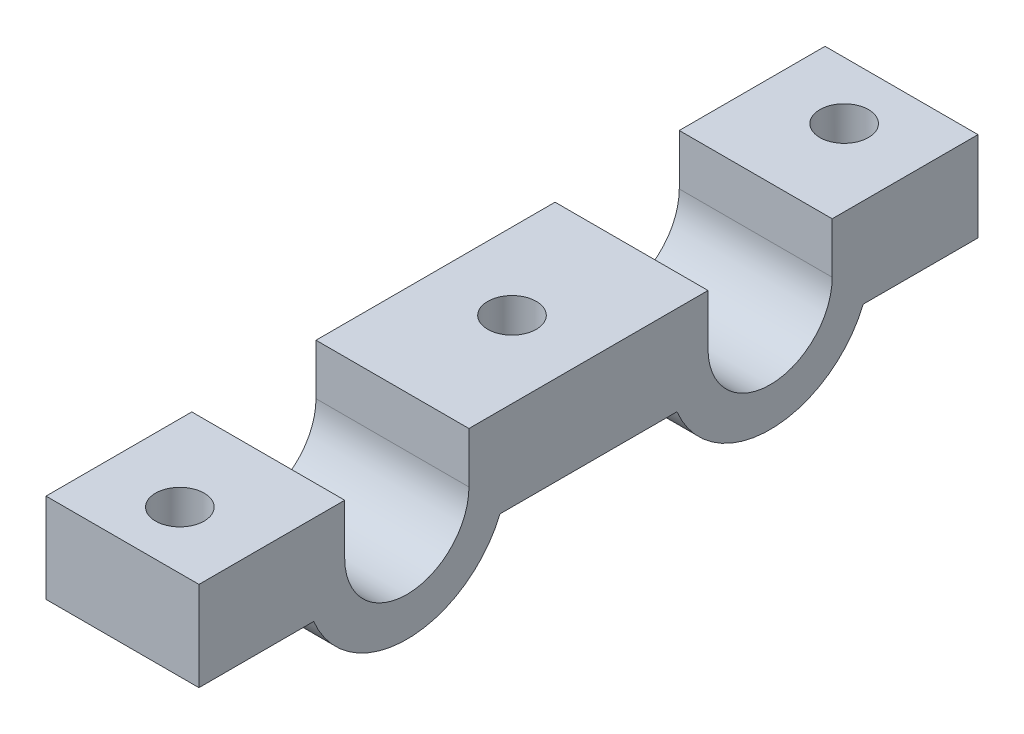
from build123d import *

# Parameters (mm, degrees)
BOSS_EXTRUDE1_DEPTH = 40
CUT_EXTRUDE1_REACH  = 161.63
SKETCH3_R           = 6.35


with BuildPart() as part:
    # Sketch2 → Boss-Extrude1 (new body)
    with BuildSketch(Plane(origin=(0, 0, 0), x_dir=(0, 0, -1), z_dir=(1, 0, 0))):
        with BuildLine():
            Line((-24.366665755, -10.16), (-54.366665755, -10.16))
            Line((-54.366665755, -10.16), (-54.366665755, 0))
            Line((-54.366665755, 0), (-54.366665755, 13.24))
            Line((-54.366665755, 13.24), (-16.24, 13.24))
            Line((-16.24, 13.24), (-16.24, 0))
            ThreePointArc((-16.24, 0), (0, -16.24), (16.24, 0))
            Line((16.24, 0), (16.24, 13.24))
            Line((16.24, 13.24), (78.76, 13.24))
            Line((78.76, 13.24), (78.76, 0))
            ThreePointArc((78.76, 0), (95, -16.24), (111.24, 0))
            Line((111.24, 0), (111.24, 13.24))
            Line((111.24, 13.24), (149.366665755, 13.24))
            Line((149.366665755, 13.24), (149.366665755, 0))
            Line((149.366665755, 0), (149.366665755, -10.16))
            Line((149.366665755, -10.16), (119.366665755, -10.16))
            ThreePointArc((119.366665755, -10.16), (95, -26.4), (70.633334245, -10.16))
            Line((70.633334245, -10.16), (24.366665755, -10.16))
            ThreePointArc((24.366665755, -10.16), (0, -26.4), (-24.366665755, -10.16))
        make_face()
    extrude(amount=BOSS_EXTRUDE1_DEPTH)

    # Sketch3 → Cut-Extrude1 (cut, up to next)
    with BuildSketch(Plane(origin=(0, 13.24, 0), x_dir=(1, 0, 0), z_dir=(0, 1, 0)), mode=Mode.PRIVATE) as cut_extrude1_sk1:
        with Locations((20, -39.366665755)):
            Circle(SKETCH3_R)
    cut_extrude1_tool1 = extrude(cut_extrude1_sk1.sketch, amount=-CUT_EXTRUDE1_REACH, mode=Mode.PRIVATE) & part.part
    # Sketch3 → Cut-Extrude1 (cut, up to next)
    with BuildSketch(Plane(origin=(0, 13.24, 0), x_dir=(1, 0, 0), z_dir=(0, 1, 0)), mode=Mode.PRIVATE) as cut_extrude1_sk2:
        with Locations((20, 134.366665755)):
            Circle(SKETCH3_R)
    cut_extrude1_tool2 = extrude(cut_extrude1_sk2.sketch, amount=-CUT_EXTRUDE1_REACH, mode=Mode.PRIVATE) & part.part
    # Sketch3 → Cut-Extrude1 (cut, up to next)
    with BuildSketch(Plane(origin=(0, 13.24, 0), x_dir=(1, 0, 0), z_dir=(0, 1, 0)), mode=Mode.PRIVATE) as cut_extrude1_sk3:
        with Locations((20, 47.5)):
            Circle(SKETCH3_R)
    cut_extrude1_tool3 = extrude(cut_extrude1_sk3.sketch, amount=-CUT_EXTRUDE1_REACH, mode=Mode.PRIVATE) & part.part
    add(cut_extrude1_tool1.solids().sort_by_distance((20, 13.24, 39.366666))[0], mode=Mode.SUBTRACT)
    add(cut_extrude1_tool2.solids().sort_by_distance((20, 13.24, -134.366666))[0], mode=Mode.SUBTRACT)
    add(cut_extrude1_tool3.solids().sort_by_distance((20, 13.24, -47.5))[0], mode=Mode.SUBTRACT)


solid = part.part
